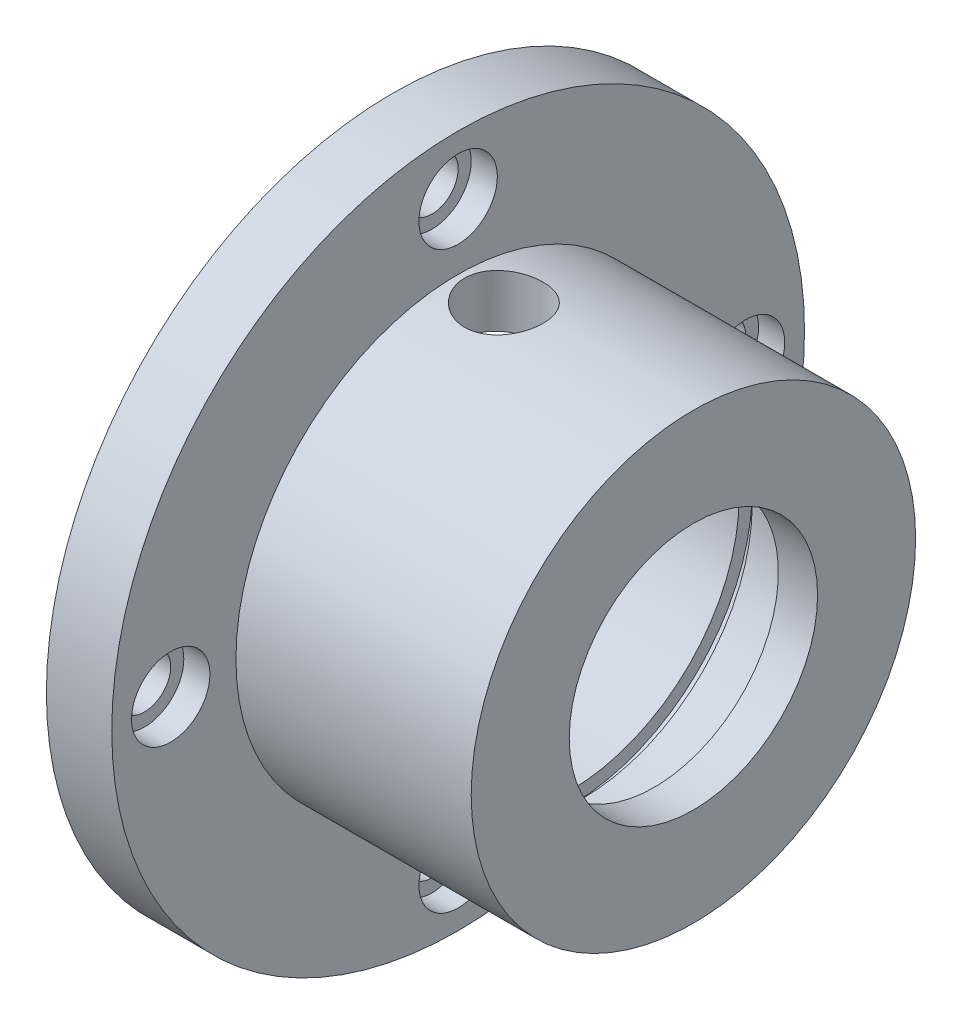
from build123d import *

# Parameters (mm, degrees)
SKETCH1_R           = 26.5
SKETCH1_R_2         = 2
BOSS_EXTRUDE1_DEPTH = 11.5
CUT_EXTRUDE1_START  = -18
SKETCH2_R           = 26.5
SKETCH2_R_2         = 2
SKETCH2_R_3         = 17
CUT_EXTRUDE1_DEPTH  = 18
SKETCH3_R           = 13
CUT_EXTRUDE2_DEPTH  = 20
SKETCH4_R           = 9.5
CUT_EXTRUDE3_DEPTH  = 20
SKETCH5_R           = 14
CUT_EXTRUDE4_DEPTH  = 0.5
SKETCH6_R           = 3
CUT_EXTRUDE5_DEPTH  = 33
SKETCH9_R           = 3
CUT_EXTRUDE7_DEPTH  = 2


with BuildPart() as part:
    # Sketch1 → Boss-Extrude1 (new, symmetric)
    with BuildSketch(Plane(origin=(0, 0, 0), x_dir=(0, 0, -1), z_dir=(1, 0, 0))):
        Circle(SKETCH1_R)
        with Locations((0, -21.987670406)):
            Circle(SKETCH1_R_2, mode=Mode.SUBTRACT)
        with Locations((-21.987670406, 0)):
            Circle(SKETCH1_R_2, mode=Mode.SUBTRACT)
        with Locations((0, 21.987670406)):
            Circle(SKETCH1_R_2, mode=Mode.SUBTRACT)
        with Locations((21.987670406, 0)):
            Circle(SKETCH1_R_2, mode=Mode.SUBTRACT)
    extrude(amount=BOSS_EXTRUDE1_DEPTH, both=True)

    # Sketch2 → Cut-Extrude1 (cut)
    with BuildSketch(Plane(origin=(11.5, 0, 0), x_dir=(0, 0, -1), z_dir=(1, 0, 0)).offset(CUT_EXTRUDE1_START)):
        Circle(SKETCH2_R)
        with Locations((0, -21.987670406)):
            Circle(SKETCH2_R_2, mode=Mode.SUBTRACT)
        with Locations((-21.987670406, 0)):
            Circle(SKETCH2_R_2, mode=Mode.SUBTRACT)
        with Locations((0, 21.987670406)):
            Circle(SKETCH2_R_2, mode=Mode.SUBTRACT)
        Circle(SKETCH2_R_3, mode=Mode.SUBTRACT)
        with Locations((21.987670406, 0)):
            Circle(SKETCH2_R_2, mode=Mode.SUBTRACT)
    extrude(amount=CUT_EXTRUDE1_DEPTH, mode=Mode.SUBTRACT)

    # Sketch3 → Cut-Extrude2 (cut)
    with BuildSketch(Plane.ZY.offset(11.5)):
        Circle(SKETCH3_R)
    extrude(amount=-CUT_EXTRUDE2_DEPTH, mode=Mode.SUBTRACT)

    # Sketch4 → Cut-Extrude3 (cut)
    with BuildSketch(Plane.ZY.offset(-8.5)):
        Circle(SKETCH4_R)
    extrude(amount=-CUT_EXTRUDE3_DEPTH, mode=Mode.SUBTRACT)

    # Sketch5 → Cut-Extrude4 (cut, symmetric)
    with BuildSketch(Plane.ZY.offset(-2.5)):
        Circle(SKETCH5_R)
    extrude(amount=CUT_EXTRUDE4_DEPTH, both=True, mode=Mode.SUBTRACT)

    # Sketch6 → Cut-Extrude5 (cut)
    with BuildSketch(Plane(origin=(0, 0, 0), x_dir=(1, 0, 0), z_dir=(0, 1, 0))):
        with Locations((-3, 0)):
            Circle(SKETCH6_R)
    extrude(amount=CUT_EXTRUDE5_DEPTH, mode=Mode.SUBTRACT)

    # Sketch9 → Cut-Extrude7 (cut)
    with BuildSketch(Plane(origin=(-6.5, 0, 0), x_dir=(0, 0, -1), z_dir=(1, 0, 0))):
        with Locations((0, 21.987670406)):
            Circle(SKETCH9_R)
        with Locations((21.987670406, 0)):
            Circle(SKETCH9_R)
        with Locations((0, -21.987670406)):
            Circle(SKETCH9_R)
        with Locations((-21.987670406, 0)):
            Circle(SKETCH9_R)
    extrude(amount=-CUT_EXTRUDE7_DEPTH, mode=Mode.SUBTRACT)


solid = part.part
